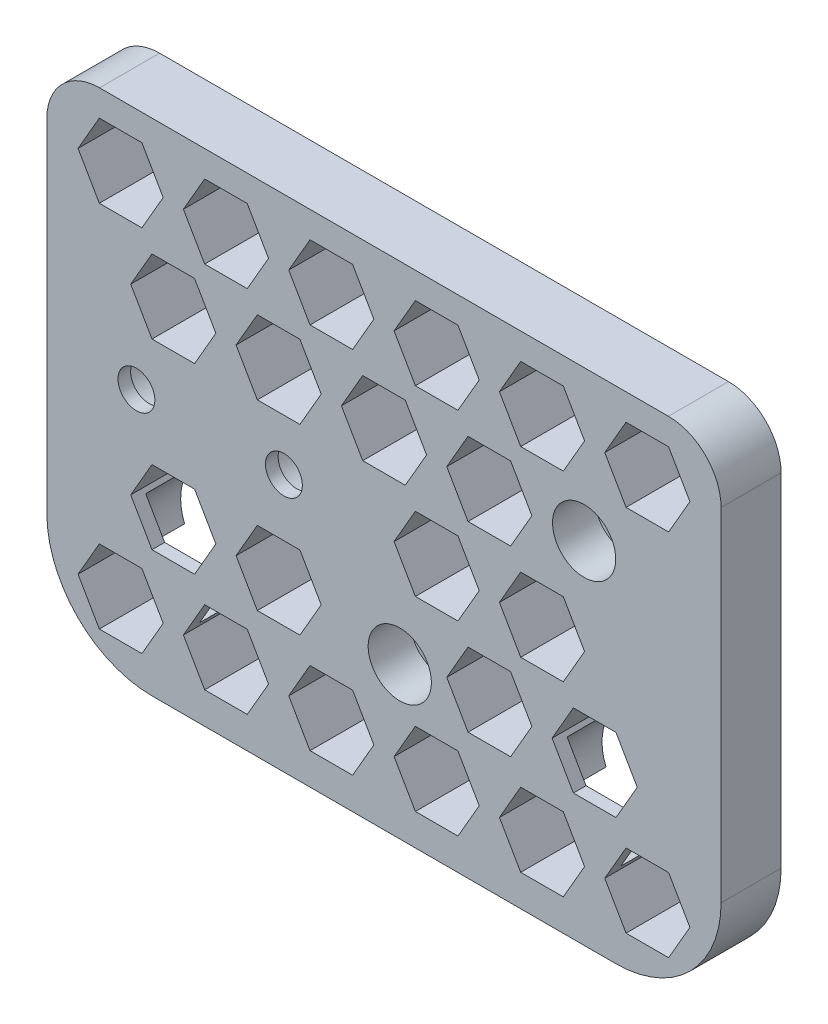
from build123d import *

# Parameters (mm, degrees)
SKETCH2_R            = 5
SKETCH2_R_2          = 1.75
SKETCH2_R_3          = 3.2
BOSS_EXTRUDE1_DEPTH  = 4.5
FILLET1_R            = 0.8
SKETCH4_R            = 1.75
BOSS_EXTRUDE2_DEPTH  = 1.2
SKETCH5_R            = 3
CUT_EXTRUDE1_DEPTH   = 4
CUT_EXTRUDE2_DEPTH   = 10
FILLET2_R            = 5
FILL_PATTERN5_DEPTH  = 5.7
LPATTERN2_COUNT      = 6
LPATTERN2_PITCH      = 10
LPATTERN2_COUNT_DIR2 = 2
LPATTERN2_PITCH_DIR2 = 35


# Read off the part's stored shape, not the designer's step: Fill Pattern5
with BuildPart() as part:
    # Sketch2 → Boss-Extrude1 (new body)
    with BuildSketch(Plane.XY):
        with BuildLine():
            Line((416.141976629, -148.960570444), (440.141976629, -148.960570444))
            Line((440.141976629, -148.960570444), (460.141976629, -148.960570444))
            Line((460.141976629, -148.960570444), (460.141976629, -186.460570444))
            ThreePointArc((460.141976629, -186.460570444), (457.213044441, -193.531638256), (450.141976629, -196.460570444))
            Line((450.141976629, -196.460570444), (406.141976629, -196.460570444))
            ThreePointArc((406.141976629, -196.460570444), (399.070908817, -193.531638256), (396.141976629, -186.460570444))
            Line((396.141976629, -186.460570444), (396.141976629, -148.960570444))
            Line((396.141976629, -148.960570444), (416.141976629, -148.960570444))
        make_face()
        with Locations((408.141976629, -184.560570444)):
            Circle(SKETCH2_R, mode=Mode.SUBTRACT)
        with Locations((448.141976629, -184.560570444)):
            Circle(SKETCH2_R, mode=Mode.SUBTRACT)
        with Locations((447.141976629, -163.210570444)):
            Circle(SKETCH2_R_2, mode=Mode.SUBTRACT)
        with Locations((429.641976629, -182.110570444)):
            Circle(SKETCH2_R_2, mode=Mode.SUBTRACT)
        with Locations((418.641976629, -172.010570444)):
            Circle(SKETCH2_R_3, mode=Mode.SUBTRACT)
        with Locations((404.641976629, -172.010570444)):
            Circle(SKETCH2_R_3, mode=Mode.SUBTRACT)
    extrude(amount=BOSS_EXTRUDE1_DEPTH)

    # Fillet1
    fillet1_edges = [part.edges().sort_by_distance(p)[0] for p in [
        (401.441976629, -172.010570444, 0),
        (415.441976629, -172.010570444, 0),
    ]]
    fillet(fillet1_edges, radius=FILLET1_R)

    # Sketch4 → Boss-Extrude2 (add)
    with BuildSketch(Plane.XY.offset(4.5)):
        with BuildLine():
            Line((460.141976629, -148.960570444), (396.141976629, -148.960570444))
            Line((396.141976629, -148.960570444), (396.141976629, -186.460570444))
            ThreePointArc((396.141976629, -186.460570444), (399.070908817, -193.531638256), (406.141976629, -196.460570444))
            Line((406.141976629, -196.460570444), (450.141976629, -196.460570444))
            ThreePointArc((450.141976629, -196.460570444), (457.213044441, -193.531638256), (460.141976629, -186.460570444))
            Line((460.141976629, -186.460570444), (460.141976629, -148.960570444))
        make_face()
        with Locations((404.641976629, -172.010570444)):
            Circle(SKETCH4_R, mode=Mode.SUBTRACT)
        with Locations((418.641976629, -172.010570444)):
            Circle(SKETCH4_R, mode=Mode.SUBTRACT)
        with Locations((429.641976629, -182.110570444)):
            Circle(SKETCH4_R, mode=Mode.SUBTRACT)
        with Locations((447.141976629, -163.210570444)):
            Circle(SKETCH4_R, mode=Mode.SUBTRACT)
    extrude(amount=BOSS_EXTRUDE2_DEPTH)

    # Sketch5 → Cut-Extrude1 (cut)
    with BuildSketch(Plane.XY.offset(5.7)):
        with Locations((447.141976629, -163.210570444)):
            Circle(SKETCH5_R)
        with Locations((429.641976629, -182.110570444)):
            Circle(SKETCH5_R)
    extrude(amount=-CUT_EXTRUDE1_DEPTH, mode=Mode.SUBTRACT)

    # Sketch6 → Cut-Extrude2 (cut)
    with BuildSketch(Plane.XY.offset(5.7)):
        Polygon((407.183428513, -154.960570444), (405.162702571, -151.460570444), (401.121250687, -151.460570444), (399.100524745, -154.960570444), (401.121250687, -158.460570444), (405.162702571, -158.460570444), align=None)
    cut_extrude2 = extrude(amount=-CUT_EXTRUDE2_DEPTH, mode=Mode.SUBTRACT)

    # Fillet2
    fillet2_edges = [part.edges().sort_by_distance(p)[0] for p in [
        (460.141976629, -148.960570444, 2.85),
        (396.141976629, -148.960570444, 2.85),
    ]]
    fillet(fillet2_edges, radius=FILLET2_R)

    # Fill Pattern5 outline → Fill Pattern5 (cut)
    with BuildSketch(Plane.XY):
        Polygon((406.121250687, -160.120824482), (404.100524745, -163.620824482), (406.121250687, -167.120824482), (410.162702571, -167.120824482), (412.183428513, -163.620824482), (410.162702571, -160.120824482), align=None)
        Polygon((416.121250687, -177.441332558), (414.100524745, -180.941332558), (416.121250687, -184.441332558), (420.162702571, -184.441332558), (422.183428513, -180.941332558), (420.162702571, -177.441332558), align=None)
        Polygon((410.162702571, -177.441332558), (406.121250687, -177.441332558), (404.100524745, -180.941332558), (406.121250687, -184.441332558), (410.162702571, -184.441332558), (412.183428513, -180.941332558), align=None)
        Polygon((420.162702571, -160.120824482), (416.121250687, -160.120824482), (414.100524745, -163.620824482), (416.121250687, -167.120824482), (420.162702571, -167.120824482), (422.183428513, -163.620824482), align=None)
        Polygon((452.183428513, -180.941332558), (450.162702571, -177.441332558), (446.121250687, -177.441332558), (444.100524745, -180.941332558), (446.121250687, -184.441332558), (450.162702571, -184.441332558), align=None)
        Polygon((442.183428513, -180.941332558), (440.162702571, -177.441332558), (436.121250687, -177.441332558), (434.100524745, -180.941332558), (436.121250687, -184.441332558), (440.162702571, -184.441332558), align=None)
        Polygon((440.162702571, -167.120824482), (442.183428513, -163.620824482), (440.162702571, -160.120824482), (436.121250687, -160.120824482), (434.100524745, -163.620824482), (436.121250687, -167.120824482), align=None)
        Polygon((445.162702571, -175.78107852), (447.183428513, -172.28107852), (445.162702571, -168.78107852), (441.121250687, -168.78107852), (439.100524745, -172.28107852), (441.121250687, -175.78107852), align=None)
        Polygon((424.100524745, -163.620824482), (426.121250687, -167.120824482), (430.162702571, -167.120824482), (432.183428513, -163.620824482), (430.162702571, -160.120824482), (426.121250687, -160.120824482), align=None)
        Polygon((431.121250687, -175.78107852), (435.162702571, -175.78107852), (437.183428513, -172.28107852), (435.162702571, -168.78107852), (431.121250687, -168.78107852), (429.100524745, -172.28107852), align=None)
    extrude(amount=FILL_PATTERN5_DEPTH, mode=Mode.SUBTRACT)

    # LPattern2: Cut-Extrude2 6 × 2
    with Locations(*[(i * LPATTERN2_PITCH, -j * LPATTERN2_PITCH_DIR2, 0) for i in range(LPATTERN2_COUNT) for j in range(LPATTERN2_COUNT_DIR2) if (i, j) != (0, 0)]):
        add(cut_extrude2, mode=Mode.SUBTRACT)


solid = part.part
